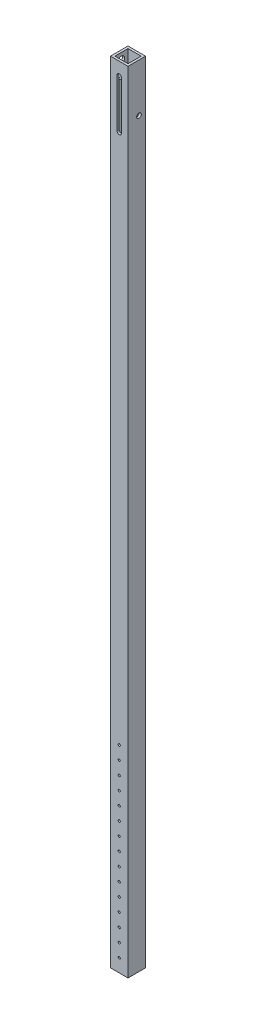
from build123d import *

# Parameters (mm, degrees)
SKETCH1_W           = 25.4
SKETCH1_H           = 25.4
SKETCH1_W_2         = 19.05
SKETCH1_H_2         = 19.05
BOSS_EXTRUDE1_DEPTH = 1143
CUT_EXTRUDE1_REACH  = 1145.353
CUT_EXTRUDE2_REACH  = 1145.353
SKETCH4_R           = 3.3782
CUT_EXTRUDE3_DEPTH  = 1144.352723354
CUT_EXTRUDE4_REACH  = 1145.353
SKETCH5_R           = 4.7625
SKETCH6_R           = 1.5875
CUT_EXTRUDE5_DEPTH  = 1144.352723354


with BuildPart() as part:
    # Sketch1 → Boss-Extrude1 (new body)
    with BuildSketch(Plane(origin=(0, 0, 0), x_dir=(1, 0, 0), z_dir=(0, 1, 0))):
        Rectangle(SKETCH1_W, SKETCH1_H)
        Rectangle(SKETCH1_W_2, SKETCH1_H_2, mode=Mode.SUBTRACT)
    extrude(amount=BOSS_EXTRUDE1_DEPTH)

    # Sketch2 → Cut-Extrude1 (cut, up to next)
    with BuildSketch(Plane(origin=(0, 0, -12.7), x_dir=(-1, 0, 0), z_dir=(0, 0, -1)), mode=Mode.PRIVATE) as cut_extrude1_sk1:
        with BuildLine():
            Line((-3.175, 990.6), (-3.175, 1104.9))
            ThreePointArc((-3.175, 1104.9), (0, 1108.075), (3.175, 1104.9))
            Line((3.175, 1104.9), (3.175, 990.6))
            ThreePointArc((3.175, 990.6), (0, 987.425), (-3.175, 990.6))
        make_face()
    cut_extrude1_tool1 = extrude(cut_extrude1_sk1.sketch, amount=-CUT_EXTRUDE1_REACH, mode=Mode.PRIVATE) & part.part
    add(cut_extrude1_tool1.solids().sort_by_distance((0, 1047.75, -12.7))[0], mode=Mode.SUBTRACT)

    # Sketch3 → Cut-Extrude2 (cut, up to next)
    with BuildSketch(Plane.XY.offset(12.7), mode=Mode.PRIVATE) as cut_extrude2_sk1:
        with BuildLine():
            Line((3.175, 1123.95), (3.175, 1054.1))
            ThreePointArc((3.175, 1054.1), (0, 1050.925), (-3.175, 1054.1))
            Line((-3.175, 1054.1), (-3.175, 1123.95))
            ThreePointArc((-3.175, 1123.95), (0, 1127.125), (3.175, 1123.95))
        make_face()
    cut_extrude2_tool1 = extrude(cut_extrude2_sk1.sketch, amount=-CUT_EXTRUDE2_REACH, mode=Mode.PRIVATE) & part.part
    add(cut_extrude2_tool1.solids().sort_by_distance((0, 1089.025, 12.7))[0], mode=Mode.SUBTRACT)

    # Sketch4 → Cut-Extrude3 (cut, through all)
    with BuildSketch(Plane.ZY.offset(12.7)):
        with Locations((-3.175, 1073.15)):
            Circle(SKETCH4_R)
    extrude(amount=-CUT_EXTRUDE3_DEPTH, mode=Mode.SUBTRACT)

    # Sketch5 → Cut-Extrude4 (cut, up to next)
    with BuildSketch(Plane.ZY.offset(12.7), mode=Mode.PRIVATE) as cut_extrude4_sk1:
        with Locations((0, 1133.475)):
            Circle(SKETCH5_R)
    cut_extrude4_tool1 = extrude(cut_extrude4_sk1.sketch, amount=-CUT_EXTRUDE4_REACH, mode=Mode.PRIVATE) & part.part
    # Sketch5 → Cut-Extrude4 (cut, up to next)
    with BuildSketch(Plane.ZY.offset(12.7), mode=Mode.PRIVATE) as cut_extrude4_sk2:
        with Locations((0, 1114.425)):
            Circle(SKETCH5_R)
    cut_extrude4_tool2 = extrude(cut_extrude4_sk2.sketch, amount=-CUT_EXTRUDE4_REACH, mode=Mode.PRIVATE) & part.part
    add(cut_extrude4_tool1.solids().sort_by_distance((-12.7, 1133.475, 0))[0], mode=Mode.SUBTRACT)
    add(cut_extrude4_tool2.solids().sort_by_distance((-12.7, 1114.425, 0))[0], mode=Mode.SUBTRACT)

    # Sketch6 → Cut-Extrude5 (cut, through all)
    with BuildSketch(Plane.XY.offset(12.7)):
        with Locations((0, 19.05)):
            Circle(SKETCH6_R)
        with Locations((0, 38.1)):
            Circle(SKETCH6_R)
        with Locations((0, 57.15)):
            Circle(SKETCH6_R)
        with Locations((0, 76.2)):
            Circle(SKETCH6_R)
        with Locations((0, 95.25)):
            Circle(SKETCH6_R)
        with Locations((0, 114.3)):
            Circle(SKETCH6_R)
        with Locations((0, 133.35)):
            Circle(SKETCH6_R)
        with Locations((0, 152.4)):
            Circle(SKETCH6_R)
        with Locations((0, 171.45)):
            Circle(SKETCH6_R)
        with Locations((0, 190.5)):
            Circle(SKETCH6_R)
        with Locations((0, 209.55)):
            Circle(SKETCH6_R)
        with Locations((0, 228.6)):
            Circle(SKETCH6_R)
        with Locations((0, 247.65)):
            Circle(SKETCH6_R)
        with Locations((0, 266.7)):
            Circle(SKETCH6_R)
        with Locations((0, 285.75)):
            Circle(SKETCH6_R)
    extrude(amount=-CUT_EXTRUDE5_DEPTH, mode=Mode.SUBTRACT)


solid = part.part
